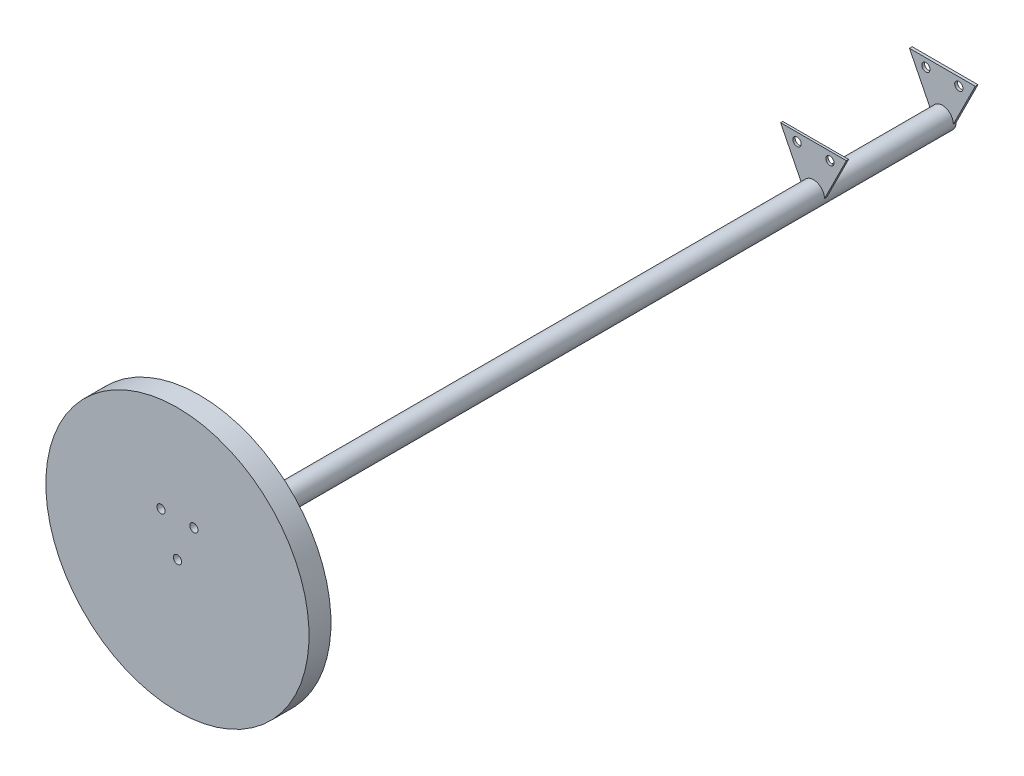
from build123d import *

# Parameters (mm, degrees)
END_TAB_1_DEPTH     = 3.175
SKETCH4_R           = 4.7625
END_TAB_1_CUT_DEPTH = 915.752709753
BOSS_EXTRUDE1_START = 2.54
SKETCH5_R           = 4.7625
BOSS_EXTRUDE1_DEPTH = 2.54


with BuildPart() as part:
    # Sketch1 → OAL Revolve (revolve)
    with BuildSketch(Plane(origin=(0, 0, 0), x_dir=(0, 0, -1), z_dir=(1, 0, 0))):
        Polygon((-444.5, 0), (444.5, 0), (444.5, 12.7), (-419.1, 12.7), (-419.1, 152.4), (-444.5, 152.4), align=None)
    revolve(axis=Axis((0, 0, 444.5), (0, 0, -1)))

    # Sketch3 → End Tab 1 (add)
    with BuildSketch(Plane(origin=(0, 0, -444.5), x_dir=(-1, 0, 0), z_dir=(0, 0, -1))):
        Polygon((12.7, 0), (-12.7, 0), (-38.1, 50.8), (38.1, 50.8), align=None)
    extrude(amount=-END_TAB_1_DEPTH)

    # Sketch4 → End Tab 1 Cut (cut, through all)
    with BuildSketch(Plane(origin=(0, 0, -444.5), x_dir=(-1, 0, 0), z_dir=(0, 0, -1))):
        with Locations((-19.05, 41.275)):
            Circle(SKETCH4_R)
        with Locations((19.05, 41.275)):
            Circle(SKETCH4_R)
        Circle(SKETCH4_R)
    extrude(amount=-END_TAB_1_CUT_DEPTH, mode=Mode.SUBTRACT)

    # Sketch5 → Boss-Extrude1 (add)
    with BuildSketch(Plane(origin=(0, 0, -292.1), x_dir=(-1, 0, 0), z_dir=(0, 0, -1)).offset(BOSS_EXTRUDE1_START)):
        with BuildLine():
            Line((12.7, 0), (38.1, 50.8))
            Line((38.1, 50.8), (-38.1, 50.8))
            Line((-38.1, 50.8), (-12.7, 0))
            ThreePointArc((-12.7, 0), (0, 12.7), (12.7, 0))
        make_face()
        with Locations((19.05, 41.275)):
            Circle(SKETCH5_R, mode=Mode.SUBTRACT)
        with Locations((-19.05, 41.275)):
            Circle(SKETCH5_R, mode=Mode.SUBTRACT)
    extrude(amount=-BOSS_EXTRUDE1_DEPTH)


solid = part.part
